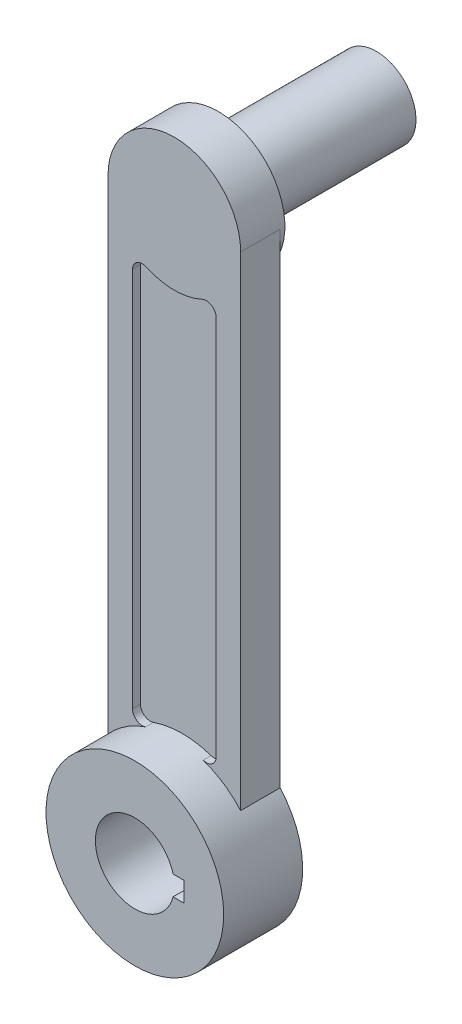
from build123d import *
from build123d.topology import SkipClean

# Parameters (mm, degrees)
SKETCH1_R            = 28.574999999999996
BASE_PIVOT_DEPTH     = 12.7
SHAFT_START          = -12.7
SHAFT_DEPTH          = 12.7
TOP_START            = 1.524
SKETCH3_R            = 21.335999999999974
TOP_SHELF_DEPTH      = 1.524
SKETCH4_R            = 12.699999999999998
TOP_PIN_DEPTH        = 50.8
FRONT_START          = -2.54
FRONT_RECESS_DEPTH   = 2.54
BACK_RECESS_DEPTH    = 2.54
BASE_HOLE_DEPTH      = 209.43551693989195
BASE_HOLE_DEPTH_BACK = 209.43551693989195
SKETCH7_R            = 12.7
KEY_WAY_DEPTH        = 209.43551693989195
KEY_WAY_DEPTH_BACK   = 209.43551693989195
FILLET1_R            = 3.175


with BuildPart() as part:
    # Sketch1 → Base pivot (new, symmetric)
    with BuildSketch(Plane.XY):
        Circle(SKETCH1_R)
    extrude(amount=BASE_PIVOT_DEPTH, both=True)

    # Sketch2 → Shaft (add)
    with BuildSketch(Plane.XY.offset(SHAFT_START)):
        with BuildLine():
            Line((-21.335999999999938, 174.625), (-21.336000000000002, 7.84e-15))
            Line((-21.336000000000002, 7.84e-15), (21.336000000000002, 0))
            Line((21.336000000000002, 0), (21.336000000000002, 174.625))
            ThreePointArc((21.336000000000002, 174.625), (3.338e-14, 195.96099999999996), (-21.335999999999938, 174.625))
        make_face()
    extrude(amount=SHAFT_DEPTH)

    # Sketch3 → Top shelf (add)
    with SkipClean():  # the faces are left unmerged after this step: merging them gives an invalid solid
        with BuildSketch(Plane(origin=(0, 0, -12.7), x_dir=(-1, 0, 0), z_dir=(0, 0, -1)).offset(TOP_START)):
            with Locations((-3.208e-14, 174.625)):
                Circle(SKETCH3_R)
        extrude(amount=-TOP_SHELF_DEPTH)

    # Sketch4 → Top pin (add)
    with SkipClean():  # the faces are left unmerged after this step: merging them gives an invalid solid
        with BuildSketch(Plane(origin=(0, 0, -14.223999999999998), x_dir=(-1, 0, 0), z_dir=(0, 0, -1))):
            with Locations((-3.208e-14, 174.625)):
                Circle(SKETCH4_R)
        extrude(amount=TOP_PIN_DEPTH)

    # Sketch5 → Front recess (cut)
    with SkipClean():  # the faces are left unmerged after this step: merging them gives an invalid solid
        with BuildSketch(Plane.XY.offset(FRONT_START)):
            with BuildLine():
                Line((-13.461999999999927, 158.07207119570683), (-13.461999999999975, 25.20526097861318))
                ThreePointArc((-13.461999999999975, 25.20526097861318), (1.75e-15, 28.574999999999992), (13.461999999999987, 25.205260978613172))
                Line((13.461999999999987, 25.205260978613172), (13.462000000000003, 158.07207119570683))
                ThreePointArc((13.462000000000003, 158.07207119570683), (3.812e-14, 153.28900000000004), (-13.461999999999927, 158.07207119570683))
            make_face()
        extrude(amount=FRONT_RECESS_DEPTH, mode=Mode.SUBTRACT)

    # Sketch6 → Back recess (cut)
    with SkipClean():  # the faces are left unmerged after this step: merging them gives an invalid solid
        with BuildSketch(Plane(origin=(0, 0, -12.7), x_dir=(-1, 0, 0), z_dir=(0, 0, -1))):
            with BuildLine():
                Line((13.461999999999929, 158.07207119570683), (13.461999999999975, 25.20526097861318))
                ThreePointArc((13.461999999999975, 25.20526097861318), (-1.094e-14, 28.574999999999992), (-13.461999999999987, 25.205260978613172))
                Line((-13.461999999999987, 25.205260978613172), (-13.461999999999998, 158.07207119570683))
                ThreePointArc((-13.461999999999998, 158.07207119570683), (-3.551e-14, 153.28900000000004), (13.461999999999929, 158.07207119570683))
            make_face()
        extrude(amount=-BACK_RECESS_DEPTH, mode=Mode.SUBTRACT)

    # Sketch7 → Base hole (cut, two sides: drawn at the far end of the back side and taken through both)
    with SkipClean():  # the faces are left unmerged after this step: merging them gives an invalid solid
        with BuildSketch(Plane.XY.offset(-BASE_HOLE_DEPTH_BACK)):
            Circle(SKETCH7_R)
        extrude(amount=BASE_HOLE_DEPTH + BASE_HOLE_DEPTH_BACK, mode=Mode.SUBTRACT)

    # Sketch8 → Key way (cut, two sides: drawn at the far end of the back side and taken through both)
    with SkipClean():  # the faces are left unmerged after this step: merging them gives an invalid solid
        with BuildSketch(Plane.XY.offset(-KEY_WAY_DEPTH_BACK)):
            Polygon((4e-16, 3.1750000000000003), (15.875, 3.174999999999997), (15.875, -3.1750000000000034), (-7.7e-16, -3.1750000000000003), align=None)
        extrude(amount=KEY_WAY_DEPTH + KEY_WAY_DEPTH_BACK, mode=Mode.SUBTRACT)

    # Fillet1
    # the kernel refuses this fillet: 3.175 mm, written as the material it adds along each edge
    with BuildSketch(Plane(origin=(-13.461999999999927, 158.07207119570683, -16.77729862803093), x_dir=(0.8483467712248999, -0.5294409842015325, 0), z_dir=(0, 0, 1))) as fillet1_piece_1_section:
        with BuildLine():
            CenterArc((5.70862475783739, -3.1502914039819587), FILLET1_R, 97.15273031823853, 114.81496184230716)
            Line((3.0151237591983637, -4.831266528821872), (0, 0))
            ThreePointArc((0, 0), (2.656645316666723, -0.16604176524117806), (5.313290633333425, -6e-17))
        make_face()
    fillet1_piece_1 = extrude(amount=16.77729862803093, mode=Mode.PRIVATE)
    fillet1_piece_1 = split(fillet1_piece_1, bisect_by=Plane(origin=(-12.378027921631585, 155.86897654595924, -12.7), z_dir=(0, 0, 1)), keep=Keep.TOP, mode=Mode.PRIVATE)
    add(fillet1_piece_1)
    with BuildSketch(Plane(origin=(13.462000000000003, 158.07207119570683, -16.777298628030998), x_dir=(0, -1, 0), z_dir=(0, 0, 1))) as fillet1_piece_2_section:
        with BuildLine():
            CenterArc((5.6949194512123995, -3.1750000000000007), FILLET1_R, 90, 114.81496184230605)
            ThreePointArc((2.813073822260918, -4.50751295336787), (1.5473979065612582, -2.1658471610760905), (0, 0))
            Line((0, 0), (5.6949194512123995, 0))
        make_face()
    fillet1_piece_2 = extrude(amount=16.777298628030998, mode=Mode.PRIVATE)
    fillet1_piece_2 = split(fillet1_piece_2, bisect_by=Plane(origin=(12.378027921631652, 155.86897654595924, -12.7), z_dir=(0, 0, 1)), keep=Keep.TOP, mode=Mode.PRIVATE)
    add(fillet1_piece_2)
    with BuildSketch(Plane(origin=(13.461999999999982, 25.205260978613172, -14.620128336437258), x_dir=(-0.9170202383773097, 0.39884067295904263, 0), z_dir=(0, 0, 1))) as fillet1_piece_3_section:
        with BuildLine():
            CenterArc((4.838757862902442, -3.1647697300383113), FILLET1_R, 94.60072202830712, 108.90500130287109)
            Line((1.9272186060544878, -4.431088866683278), (0, 0))
            ThreePointArc((0, 0), (2.2920431982169482, -0.0920724296552107), (4.584086396433892, 1.4e-16))
        make_face()
    fillet1_piece_3 = extrude(amount=14.620128336437258, mode=Mode.PRIVATE)
    fillet1_piece_3 = split(fillet1_piece_3, bisect_by=Plane(origin=(12.464896317702909, 26.864585865403097, -12.7), z_dir=(0, 0, 1)), keep=Keep.TOP, mode=Mode.PRIVATE)
    add(fillet1_piece_3)
    with BuildSketch(Plane(origin=(-13.461999999999975, 25.20526097861318, -14.620128336437222), x_dir=(0.9170202383773097, 0.3988406729590427, 0), z_dir=(0, 0, 1))) as fillet1_piece_4_section:
        with BuildLine():
            CenterArc((4.838757862902452, 3.164769730038311), FILLET1_R, 156.49427666882212, 108.90500130287074)
            Line((1.927218606054489, 4.431088866683262), (0, 0))
            ThreePointArc((0, 0), (2.292043198216952, 0.09207242965520915), (4.5840863964339, 1e-17))
        make_face()
    fillet1_piece_4 = extrude(amount=14.620128336437222, mode=Mode.PRIVATE)
    fillet1_piece_4 = split(fillet1_piece_4, bisect_by=Plane(origin=(-12.464896317702895, 26.864585865403104, -12.7), z_dir=(0, 0, 1)), keep=Keep.TOP, mode=Mode.PRIVATE)
    add(fillet1_piece_4)
    with BuildSketch(Plane(origin=(13.462, 158.07207119570683, -12.7), x_dir=(0, -1, 0), z_dir=(0, 0, 1))) as fillet1_piece_5_section:
        with BuildLine():
            CenterArc((5.6949194512123995, -3.1750000000000007), FILLET1_R, 90, 114.81496184230605)
            ThreePointArc((2.813073822260918, -4.50751295336787), (1.5473979065612582, -2.1658471610760905), (0, 0))
            Line((0, 0), (5.6949194512123995, 0))
        make_face()
    fillet1_piece_5 = extrude(amount=16.777298628031005, mode=Mode.PRIVATE)
    fillet1_piece_5 = split(fillet1_piece_5, bisect_by=Plane(origin=(12.378027921631652, 155.86897654595924, 0), z_dir=(0, 0, -1)), keep=Keep.TOP, mode=Mode.PRIVATE)
    add(fillet1_piece_5)
    with BuildSketch(Plane(origin=(-13.46199999999993, 158.07207119570683, -12.7), x_dir=(-3.1e-16, -1, 0), z_dir=(0, 0, 1))) as fillet1_piece_6_section:
        with BuildLine():
            CenterArc((5.6949194512124555, 3.1750000000000007), FILLET1_R, 155.18503815769455, 114.81496184230548)
            ThreePointArc((2.8130738222609453, 4.507512953367848), (1.5473979065612575, 2.1658471610760963), (0, 0))
            Line((0, 0), (5.694919451212456, 0))
        make_face()
    fillet1_piece_6 = extrude(amount=16.777298628031147, mode=Mode.PRIVATE)
    fillet1_piece_6 = split(fillet1_piece_6, bisect_by=Plane(origin=(-12.378027921631558, 155.86897654595919, 0), z_dir=(0, 0, -1)), keep=Keep.TOP, mode=Mode.PRIVATE)
    add(fillet1_piece_6)
    with BuildSketch(Plane(origin=(-13.461999999999975, 25.20526097861318, -12.7), x_dir=(0, 1, 0), z_dir=(0, 0, 1))) as fillet1_piece_7_section:
        with BuildLine():
            CenterArc((4.832051334574889, -3.1750000000000007), FILLET1_R, 90, 108.905001302871)
            ThreePointArc((1.8283201032560825, -4.203700000000001), (0.9985923330184399, -2.0651277701953425), (0, 0))
            Line((0, 0), (4.832051334574889, 0))
        make_face()
    fillet1_piece_7 = extrude(amount=14.620128336437226, mode=Mode.PRIVATE)
    fillet1_piece_7 = split(fillet1_piece_7, bisect_by=Plane(origin=(-12.4648963177029, 26.8645858654031, 0), z_dir=(0, 0, -1)), keep=Keep.TOP, mode=Mode.PRIVATE)
    add(fillet1_piece_7)
    with BuildSketch(Plane(origin=(13.46199999999999, 25.205260978613172, -12.7), x_dir=(-0.9170202383773102, 0.3988406729590419, 0), z_dir=(0, 0, 1))) as fillet1_piece_8_section:
        with BuildLine():
            CenterArc((4.838757862902448, -3.164769730038312), FILLET1_R, 94.60072202830708, 108.905001302871)
            Line((1.927218606054491, -4.4310888666832735), (0, 0))
            ThreePointArc((0, 0), (2.2920431982169456, -0.09207242965520608), (4.584086396433901, -1e-17))
        make_face()
    fillet1_piece_8 = extrude(amount=14.620128336437253, mode=Mode.PRIVATE)
    fillet1_piece_8 = split(fillet1_piece_8, bisect_by=Plane(origin=(12.464896317702909, 26.8645858654031, 0), z_dir=(0, 0, -1)), keep=Keep.TOP, mode=Mode.PRIVATE)
    add(fillet1_piece_8)


solid = part.part
